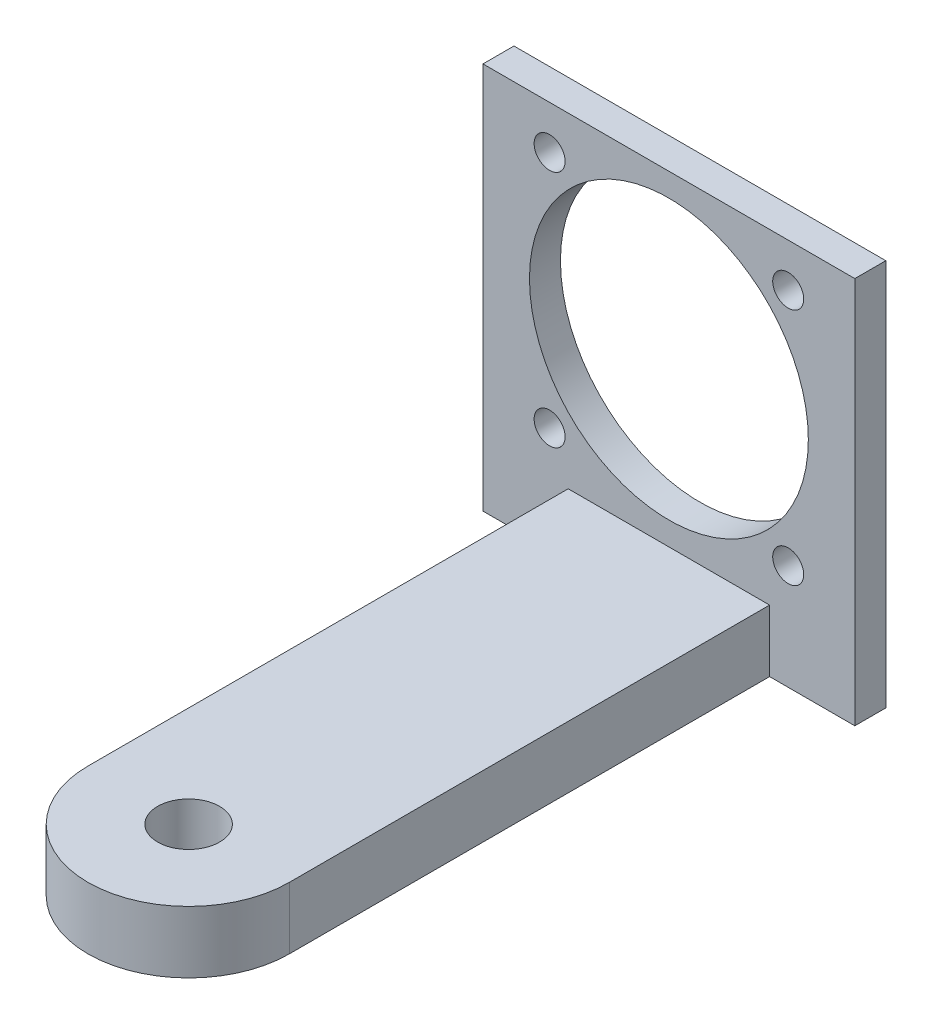
from build123d import *

# Parameters (mm, degrees)
SKETCH_2_R          = 6.5
EXTRUDE_1_DEPTH     = 4
SKETCH_3_R          = 2
CUT_EXTRUDE_2_DEPTH = 11.024968828
EXTRUDE_START       = -4
EXTRUDE_2_DEPTH     = 4
EXTRUDE_3_DEPTH     = 2
SKETCH_22_R         = 9
SKETCH_22_R_2       = 1
CUT_EXTRUDE_4_DEPTH = 2


with BuildPart() as part:
    # 草图2 → 凸台-拉伸1 (new body)
    with BuildSketch(Plane(origin=(0, 0, 0), x_dir=(1, 0, 0), z_dir=(0, 1, 0))):
        Circle(SKETCH_2_R)
    extrude(amount=EXTRUDE_1_DEPTH)

    # 草图3 → 切除-拉伸2 (cut, through all)
    with BuildSketch(Plane(origin=(0, 4, 0), x_dir=(1, 0, 0), z_dir=(0, 1, 0))):
        Circle(SKETCH_3_R)
    extrude(amount=-CUT_EXTRUDE_2_DEPTH, mode=Mode.SUBTRACT)

    # 草图4 → 凸台-拉伸2 (add)
    with BuildSketch(Plane(origin=(0, 4, 0), x_dir=(1, 0, 0), z_dir=(0, 1, 0)).offset(EXTRUDE_START)):
        with BuildLine():
            Line((6.5, 0), (6.5, 31))
            Line((6.5, 31), (3.899148682, 31))
            Line((3.899148682, 31), (-4.100851318, 31))
            Line((-4.100851318, 31), (-6.5, 31))
            Line((-6.5, 31), (-6.5, 0))
            ThreePointArc((-6.5, 0), (0, 6.5), (6.5, 0))
        make_face()
    extrude(amount=EXTRUDE_2_DEPTH)

    # 草图21 → 凸台-拉伸3 (add)
    with BuildSketch(Plane(origin=(0, 0, -31), x_dir=(-1, 0, 0), z_dir=(0, 0, -1))):
        Polygon((0, 0), (12, 0), (12, 25), (-12, 25), (-12, 0), align=None)
    extrude(amount=EXTRUDE_3_DEPTH)

    # 草图22 → 切除-拉伸4 (cut)
    with BuildSketch(Plane.XY.offset(-31)):
        with Locations((0, 14.5)):
            Circle(SKETCH_22_R)
        with Locations((7.7, 22.2)):
            Circle(SKETCH_22_R_2)
        with Locations((-7.7, 22.2)):
            Circle(SKETCH_22_R_2)
        with Locations((-7.7, 6.8)):
            Circle(SKETCH_22_R_2)
        with Locations((7.7, 6.8)):
            Circle(SKETCH_22_R_2)
    extrude(amount=-CUT_EXTRUDE_4_DEPTH, mode=Mode.SUBTRACT)


solid = part.part
